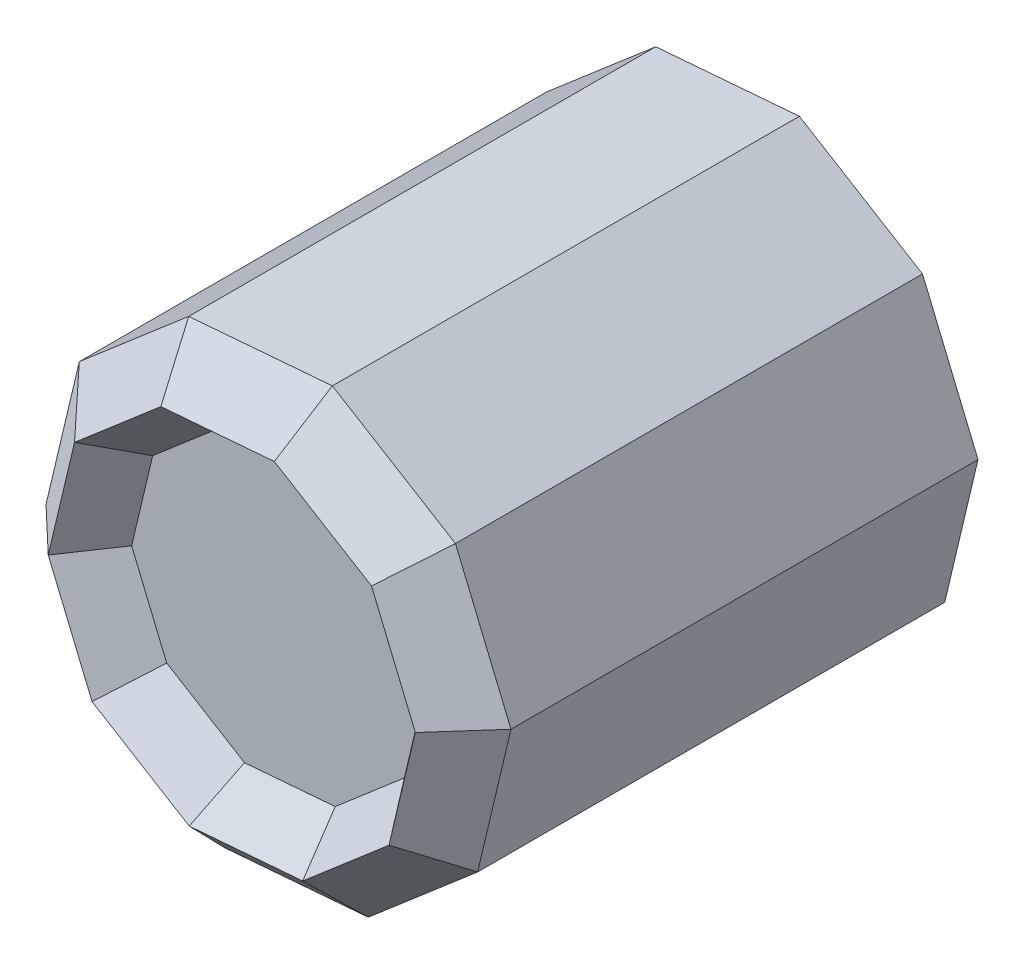
from build123d import *

# Parameters (mm, degrees)
SKETCH_1_R      = 3.05
EXTRUDE_1_DEPTH = 11
SKETCH_2_R      = 3.098235282
EXTRUDE_2_DEPTH = 2
EXTRUDE_START   = 7
EXTRUDE_3_DEPTH = 7
CHAMFER_1_SIZE  = 1


with BuildPart() as part:
    # 草图1 → 凸台-拉伸1 (new body)
    with BuildSketch(Plane.XY):
        Polygon((1.153571241, 4.859399129), (-1.923024405, 4.609388641), (-4.265090089, 2.598748359), (-4.978036325, -0.404525468), (-3.789541881, -3.253284315), (-1.153571241, -4.859399129), (1.923024405, -4.609388641), (4.265090089, -2.598748359), (4.978036325, 0.404525468), (3.789541881, 3.253284315), align=None)
        Circle(SKETCH_1_R, mode=Mode.SUBTRACT)
    extrude(amount=EXTRUDE_1_DEPTH)

    # 草图2 → 凸台-拉伸2 (add)
    with BuildSketch(Plane.XY.offset(11)):
        Circle(SKETCH_2_R)
    extrude(amount=-EXTRUDE_2_DEPTH)

    # 草图3 → 凸台-拉伸3 (add)
    with BuildSketch(Plane(origin=(0, 0, 9), x_dir=(-1, 0, 0), z_dir=(0, 0, -1)).offset(EXTRUDE_START)):
        with BuildLine():
            Line((1.45, 2.683281573), (1.45, -2.683281573))
            ThreePointArc((1.45, -2.683281573), (3.05, 0), (1.45, 2.683281573))
        make_face()
    extrude(amount=-EXTRUDE_3_DEPTH)

    # 倒角1
    chamfer_1_edges = [part.edges().sort_by_distance(p)[0] for p in [
        (4.383789103, 1.828904891, 11),
        (4.621563207, -1.097111446, 11),
        (3.094057247, -3.6040685, 11),
        (0.384726582, -4.734393885, 11),
        (-2.471556561, -4.056341722, 11),
        (-4.383789103, -1.828904891, 11),
        (-4.621563207, 1.097111446, 11),
        (-3.094057247, 3.6040685, 11),
        (-0.384726582, 4.734393885, 11),
        (2.471556561, 4.056341722, 11),
    ]]
    chamfer(chamfer_1_edges, length=CHAMFER_1_SIZE)

    # 草图5 → 切除-放样1 section 0
    with BuildSketch(Plane.XY.offset(11)):
        with BuildLine():
            Line((0.910714137, 3.836367733), (-1.518177162, 3.638991032))
            Line((-1.518177162, 3.638991032), (-3.367176386, 2.051643441))
            Line((-3.367176386, 2.051643441), (-3.930028677, -0.319362211))
            Line((-3.930028677, -0.319362211), (-2.99174359, -2.568382354))
            Line((-2.99174359, -2.568382354), (-0.910714137, -3.836367733))
            Line((-0.910714137, -3.836367733), (1.518177162, -3.638991032))
            Line((1.518177162, -3.638991032), (3.367176386, -2.051643441))
            Line((3.367176386, -2.051643441), (3.930028677, 0.319362211))
            Line((3.930028677, 0.319362211), (2.99174359, 2.568382354))
            Line((2.99174359, 2.568382354), (0.910714137, 3.836367733))
        make_face()
    # 草图4 → 切除-放样1 section 1
    with BuildSketch(Plane.XY.offset(10)):
        with BuildLine():
            Line((0.72857131, 3.069094187), (-1.21454173, 2.911192826))
            Line((-1.21454173, 2.911192826), (-2.693741109, 1.641314753))
            Line((-2.693741109, 1.641314753), (-3.144022942, -0.255489769))
            Line((-3.144022942, -0.255489769), (-2.393394872, -2.054705883))
            Line((-2.393394872, -2.054705883), (-0.72857131, -3.069094187))
            Line((-0.72857131, -3.069094187), (1.21454173, -2.911192826))
            Line((1.21454173, -2.911192826), (2.693741109, -1.641314753))
            Line((2.693741109, -1.641314753), (3.144022942, 0.255489769))
            Line((3.144022942, 0.255489769), (2.393394872, 2.054705883))
            Line((2.393394872, 2.054705883), (0.72857131, 3.069094187))
        make_face()
    loft(mode=Mode.SUBTRACT)


solid = part.part
